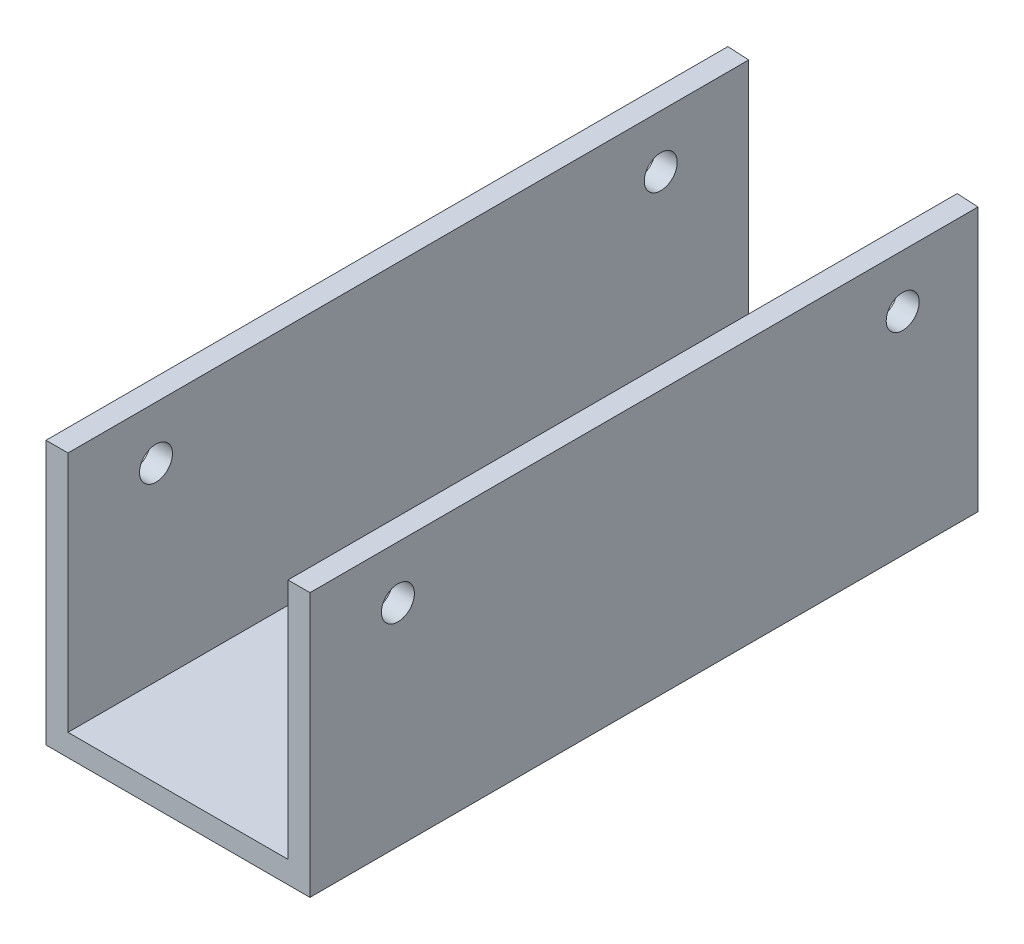
from build123d import *

# Parameters (mm, degrees)
BOSS_EXTRUDE1_DEPTH = 98.425
CUT_EXTRUDE1_DEPTH  = 98.425
SKETCH3_R           = 2.38125
CUT_EXTRUDE2_DEPTH  = 98.425


with BuildPart() as part:
    # Sketch1 → Boss-Extrude1 (new body)
    with BuildSketch(Plane.XY):
        Polygon((18.371241491, 0), (-19.728758509, 0), (-19.728758509, 38.1), (-16.553758509, 38.1), (-16.553758509, 3.175), (15.196241491, 3.175), (15.196241491, 38.1), (18.371241491, 38.1), align=None)
    extrude(amount=BOSS_EXTRUDE1_DEPTH)

    # Sketch2 → Cut-Extrude1 (cut)
    with BuildSketch(Plane(origin=(0, 38.1, 0), x_dir=(1, 0, 0), z_dir=(0, 1, 0))):
        Polygon((-19.728758509, 0), (18.371241491, 0), (18.371241491, -1.996736391), align=None)
    extrude(amount=-CUT_EXTRUDE1_DEPTH, mode=Mode.SUBTRACT)

    # Sketch3 → Cut-Extrude2 (cut)
    with BuildSketch(Plane(origin=(18.371241491, 0, 0), x_dir=(0, 0, -1), z_dir=(1, 0, 0))):
        with Locations((-12.866394699, 30.48)):
            Circle(SKETCH3_R)
        with Locations((-85.725, 30.48)):
            Circle(SKETCH3_R)
    extrude(amount=-CUT_EXTRUDE2_DEPTH, mode=Mode.SUBTRACT)


solid = part.part
